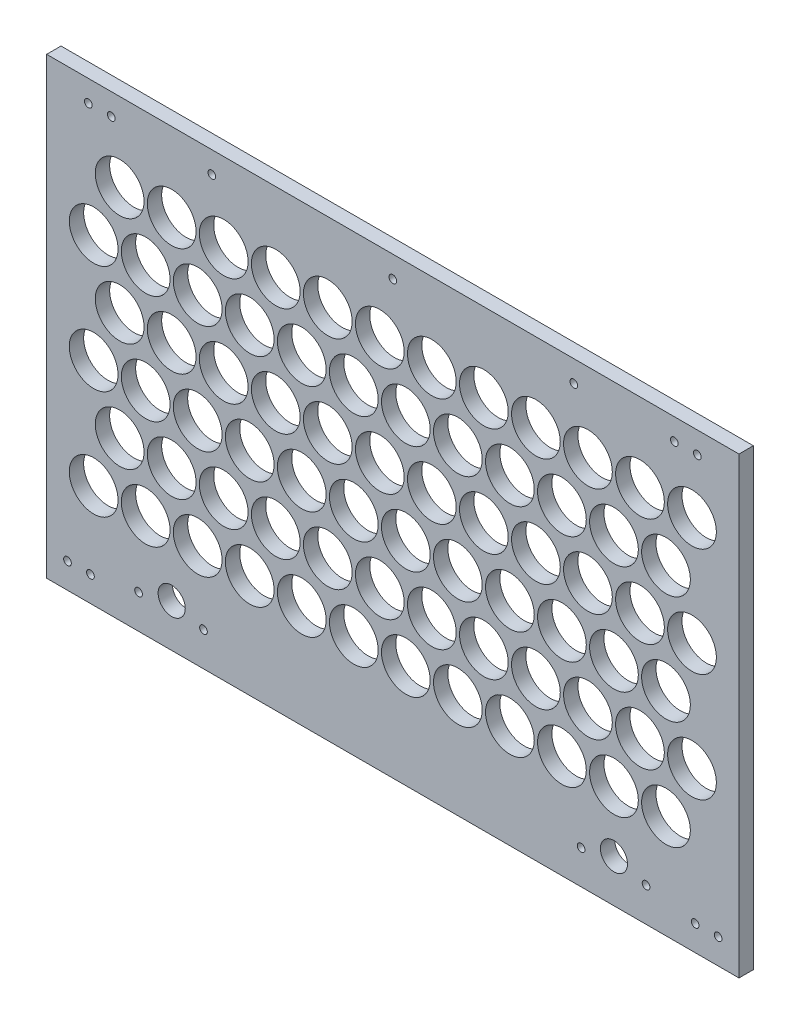
from build123d import *

# Parameters (mm, degrees)
SKETCH1_W                  = 306.05000007
SKETCH1_H                  = 197.4250001
BOSS_EXTRUDE1_DEPTH        = 6.35
CUT_EXTRUDE1_DEPTH         = 187.132543615
SKETCH4_R                  = 10.775
CUT_EXTRUDE2_DEPTH         = 187.132543615
LPATTERN1_COUNT            = 12
LPATTERN1_PITCH            = 23
LPATTERN2_COPY_1_DEPTH     = 187.132543615
LPATTERN2_COPY_2_DEPTH     = 187.132543615
LPATTERN2_COPY_3_DEPTH     = 187.132543615
LPATTERN2_COPY_4_DEPTH     = 187.132543615
LPATTERN2_COPY_5_DEPTH     = 187.132543615
LPATTERN2_COPY_6_DEPTH     = 187.132543615
LPATTERN2_COPY_7_DEPTH     = 187.132543615
LPATTERN2_COPY_8_DEPTH     = 187.132543615
LPATTERN2_COPY_9_DEPTH     = 187.132543615
LPATTERN2_COPY_10_DEPTH    = 187.132543615
LPATTERN2_COPY_11_DEPTH    = 187.132543615
LPATTERN2_COPY_12_DEPTH    = 187.132543615
LPATTERN2_COPY_13_DEPTH    = 187.132543615
LPATTERN2_COPY_14_DEPTH    = 187.132543615
LPATTERN2_COPY_15_DEPTH    = 187.132543615
LPATTERN2_COPY_16_DEPTH    = 187.132543615
LPATTERN2_COPY_17_DEPTH    = 187.132543615
LPATTERN2_COPY_18_DEPTH    = 187.132543615
LPATTERN2_COPY_19_DEPTH    = 187.132543615
LPATTERN2_COPY_20_DEPTH    = 187.132543615
LPATTERN2_COPY_21_DEPTH    = 187.132543615
LPATTERN2_COPY_22_DEPTH    = 187.132543615
LPATTERN2_COPY_23_SKETCH_R = 10.775
LPATTERN2_COPY_23_DEPTH    = 187.132543615
LPATTERN2_COPY_24_SKETCH_R = 10.775
LPATTERN2_COPY_24_DEPTH    = 187.132543615
LPATTERN2_COPY_25_SKETCH_R = 10.775
LPATTERN2_COPY_25_DEPTH    = 187.132543615
LPATTERN2_COPY_26_SKETCH_R = 10.775
LPATTERN2_COPY_26_DEPTH    = 187.132543615
LPATTERN2_COPY_27_SKETCH_R = 10.775
LPATTERN2_COPY_27_DEPTH    = 187.132543615
LPATTERN2_COPY_28_SKETCH_R = 10.775
LPATTERN2_COPY_28_DEPTH    = 187.132543615
LPATTERN2_COPY_29_SKETCH_R = 10.775
LPATTERN2_COPY_29_DEPTH    = 187.132543615
LPATTERN2_COPY_30_SKETCH_R = 10.775
LPATTERN2_COPY_30_DEPTH    = 187.132543615
LPATTERN2_COPY_31_SKETCH_R = 10.775
LPATTERN2_COPY_31_DEPTH    = 187.132543615
LPATTERN2_COPY_32_SKETCH_R = 10.775
LPATTERN2_COPY_32_DEPTH    = 187.132543615
LPATTERN2_COPY_33_SKETCH_R = 10.775
LPATTERN2_COPY_33_DEPTH    = 187.132543615
LPATTERN2_COPY_34_SKETCH_R = 10.775
LPATTERN2_COPY_34_DEPTH    = 187.132543615
LPATTERN2_COPY_35_SKETCH_R = 10.775
LPATTERN2_COPY_35_DEPTH    = 187.132543615
LPATTERN2_COPY_36_SKETCH_R = 10.775
LPATTERN2_COPY_36_DEPTH    = 187.132543615
LPATTERN2_COPY_37_SKETCH_R = 10.775
LPATTERN2_COPY_37_DEPTH    = 187.132543615
LPATTERN2_COPY_38_SKETCH_R = 10.775
LPATTERN2_COPY_38_DEPTH    = 187.132543615
LPATTERN2_COPY_39_SKETCH_R = 10.775
LPATTERN2_COPY_39_DEPTH    = 187.132543615
LPATTERN2_COPY_40_SKETCH_R = 10.775
LPATTERN2_COPY_40_DEPTH    = 187.132543615
LPATTERN2_COPY_41_SKETCH_R = 10.775
LPATTERN2_COPY_41_DEPTH    = 187.132543615
LPATTERN2_COPY_42_SKETCH_R = 10.775
LPATTERN2_COPY_42_DEPTH    = 187.132543615
LPATTERN2_COPY_43_SKETCH_R = 10.775
LPATTERN2_COPY_43_DEPTH    = 187.132543615
LPATTERN2_COPY_44_SKETCH_R = 10.775
LPATTERN2_COPY_44_DEPTH    = 187.132543615
LPATTERN2_COPY_45_DEPTH    = 187.132543615
LPATTERN2_COPY_46_DEPTH    = 187.132543615
LPATTERN2_COPY_47_SKETCH_R = 10.775
LPATTERN2_COPY_47_DEPTH    = 187.132543615
LPATTERN2_COPY_48_SKETCH_R = 10.775
LPATTERN2_COPY_48_DEPTH    = 187.132543615
SKETCH13_W                 = 306.05000007
SKETCH13_H                 = 6.35
BOSS_EXTRUDE2_DEPTH        = 3.175
SKETCH14_R                 = 6
CUT_EXTRUDE3_DEPTH         = 187.132543615
M3_CLEARANCE_HOLE1_D       = 3.4


with BuildPart() as part:
    # Sketch1 → Boss-Extrude1 (new body)
    with BuildSketch(Plane.XY):
        with Locations((3.5e-08, -7.06250005)):
            Rectangle(SKETCH1_W, SKETCH1_H)
    extrude(amount=BOSS_EXTRUDE1_DEPTH)

    # Sketch3 → Cut-Extrude1 (cut, through all)
    with BuildSketch(Plane.XY.offset(6.35)):
        with BuildLine():
            ThreePointArc((-121.475, -60), (-132.24999993, -49.225), (-143.025, -59.999999859))
            ThreePointArc((-143.025, -59.999999859), (-139.869075617, -67.619075517), (-132.25, -70.775))
            ThreePointArc((-132.25, -70.775), (-124.630924433, -67.619075567), (-121.475, -60))
        make_face()
    cut_extrude1 = extrude(amount=-CUT_EXTRUDE1_DEPTH, mode=Mode.SUBTRACT)

    # Sketch4 → Cut-Extrude2 (cut, through all)
    with BuildSketch(Plane.XY.offset(6.35)):
        with Locations((-120.75, -36)):
            Circle(SKETCH4_R)
    cut_extrude2 = extrude(amount=-CUT_EXTRUDE2_DEPTH, mode=Mode.SUBTRACT)

    # LPattern1: Cut-Extrude1, Cut-Extrude2 ×12
    with Locations(*[(i * LPATTERN1_PITCH, 0, 0) for i in range(1, LPATTERN1_COUNT)]):
        add(cut_extrude1, mode=Mode.SUBTRACT)
        add(cut_extrude2, mode=Mode.SUBTRACT)

    # LPattern2 copy 1 sketch → LPattern2 copy 1 (cut, through all)
    with BuildSketch(Plane(origin=(23, 48, 6.35), x_dir=(1, 0, 0), z_dir=(0, 0, 1))):
        with BuildLine():
            ThreePointArc((-121.475, -60), (-132.24999993, -49.225), (-143.025, -59.999999859))
            ThreePointArc((-143.025, -59.999999859), (-139.869075617, -67.619075517), (-132.25, -70.775))
            ThreePointArc((-132.25, -70.775), (-124.630924433, -67.619075567), (-121.475, -60))
        make_face()
    extrude(amount=-LPATTERN2_COPY_1_DEPTH, mode=Mode.SUBTRACT)

    # LPattern2 copy 2 sketch → LPattern2 copy 2 (cut, through all)
    with BuildSketch(Plane(origin=(23, 96, 6.35), x_dir=(1, 0, 0), z_dir=(0, 0, 1))):
        with BuildLine():
            ThreePointArc((-121.475, -60), (-132.24999993, -49.225), (-143.025, -59.999999859))
            ThreePointArc((-143.025, -59.999999859), (-139.869075617, -67.619075517), (-132.25, -70.775))
            ThreePointArc((-132.25, -70.775), (-124.630924433, -67.619075567), (-121.475, -60))
        make_face()
    extrude(amount=-LPATTERN2_COPY_2_DEPTH, mode=Mode.SUBTRACT)

    # LPattern2 copy 3 sketch → LPattern2 copy 3 (cut, through all)
    with BuildSketch(Plane(origin=(46, 48, 6.35), x_dir=(1, 0, 0), z_dir=(0, 0, 1))):
        with BuildLine():
            ThreePointArc((-121.475, -60), (-132.24999993, -49.225), (-143.025, -59.999999859))
            ThreePointArc((-143.025, -59.999999859), (-139.869075617, -67.619075517), (-132.25, -70.775))
            ThreePointArc((-132.25, -70.775), (-124.630924433, -67.619075567), (-121.475, -60))
        make_face()
    extrude(amount=-LPATTERN2_COPY_3_DEPTH, mode=Mode.SUBTRACT)

    # LPattern2 copy 4 sketch → LPattern2 copy 4 (cut, through all)
    with BuildSketch(Plane(origin=(46, 96, 6.35), x_dir=(1, 0, 0), z_dir=(0, 0, 1))):
        with BuildLine():
            ThreePointArc((-121.475, -60), (-132.24999993, -49.225), (-143.025, -59.999999859))
            ThreePointArc((-143.025, -59.999999859), (-139.869075617, -67.619075517), (-132.25, -70.775))
            ThreePointArc((-132.25, -70.775), (-124.630924433, -67.619075567), (-121.475, -60))
        make_face()
    extrude(amount=-LPATTERN2_COPY_4_DEPTH, mode=Mode.SUBTRACT)

    # LPattern2 copy 5 sketch → LPattern2 copy 5 (cut, through all)
    with BuildSketch(Plane(origin=(69, 48, 6.35), x_dir=(1, 0, 0), z_dir=(0, 0, 1))):
        with BuildLine():
            ThreePointArc((-121.475, -60), (-132.24999993, -49.225), (-143.025, -59.999999859))
            ThreePointArc((-143.025, -59.999999859), (-139.869075617, -67.619075517), (-132.25, -70.775))
            ThreePointArc((-132.25, -70.775), (-124.630924433, -67.619075567), (-121.475, -60))
        make_face()
    extrude(amount=-LPATTERN2_COPY_5_DEPTH, mode=Mode.SUBTRACT)

    # LPattern2 copy 6 sketch → LPattern2 copy 6 (cut, through all)
    with BuildSketch(Plane(origin=(69, 96, 6.35), x_dir=(1, 0, 0), z_dir=(0, 0, 1))):
        with BuildLine():
            ThreePointArc((-121.475, -60), (-132.24999993, -49.225), (-143.025, -59.999999859))
            ThreePointArc((-143.025, -59.999999859), (-139.869075617, -67.619075517), (-132.25, -70.775))
            ThreePointArc((-132.25, -70.775), (-124.630924433, -67.619075567), (-121.475, -60))
        make_face()
    extrude(amount=-LPATTERN2_COPY_6_DEPTH, mode=Mode.SUBTRACT)

    # LPattern2 copy 7 sketch → LPattern2 copy 7 (cut, through all)
    with BuildSketch(Plane(origin=(92, 48, 6.35), x_dir=(1, 0, 0), z_dir=(0, 0, 1))):
        with BuildLine():
            ThreePointArc((-121.475, -60), (-132.24999993, -49.225), (-143.025, -59.999999859))
            ThreePointArc((-143.025, -59.999999859), (-139.869075617, -67.619075517), (-132.25, -70.775))
            ThreePointArc((-132.25, -70.775), (-124.630924433, -67.619075567), (-121.475, -60))
        make_face()
    extrude(amount=-LPATTERN2_COPY_7_DEPTH, mode=Mode.SUBTRACT)

    # LPattern2 copy 8 sketch → LPattern2 copy 8 (cut, through all)
    with BuildSketch(Plane(origin=(92, 96, 6.35), x_dir=(1, 0, 0), z_dir=(0, 0, 1))):
        with BuildLine():
            ThreePointArc((-121.475, -60), (-132.24999993, -49.225), (-143.025, -59.999999859))
            ThreePointArc((-143.025, -59.999999859), (-139.869075617, -67.619075517), (-132.25, -70.775))
            ThreePointArc((-132.25, -70.775), (-124.630924433, -67.619075567), (-121.475, -60))
        make_face()
    extrude(amount=-LPATTERN2_COPY_8_DEPTH, mode=Mode.SUBTRACT)

    # LPattern2 copy 9 sketch → LPattern2 copy 9 (cut, through all)
    with BuildSketch(Plane(origin=(115, 48, 6.35), x_dir=(1, 0, 0), z_dir=(0, 0, 1))):
        with BuildLine():
            ThreePointArc((-121.475, -60), (-132.24999993, -49.225), (-143.025, -59.999999859))
            ThreePointArc((-143.025, -59.999999859), (-139.869075617, -67.619075517), (-132.25, -70.775))
            ThreePointArc((-132.25, -70.775), (-124.630924433, -67.619075567), (-121.475, -60))
        make_face()
    extrude(amount=-LPATTERN2_COPY_9_DEPTH, mode=Mode.SUBTRACT)

    # LPattern2 copy 10 sketch → LPattern2 copy 10 (cut, through all)
    with BuildSketch(Plane(origin=(115, 96, 6.35), x_dir=(1, 0, 0), z_dir=(0, 0, 1))):
        with BuildLine():
            ThreePointArc((-121.475, -60), (-132.24999993, -49.225), (-143.025, -59.999999859))
            ThreePointArc((-143.025, -59.999999859), (-139.869075617, -67.619075517), (-132.25, -70.775))
            ThreePointArc((-132.25, -70.775), (-124.630924433, -67.619075567), (-121.475, -60))
        make_face()
    extrude(amount=-LPATTERN2_COPY_10_DEPTH, mode=Mode.SUBTRACT)

    # LPattern2 copy 11 sketch → LPattern2 copy 11 (cut, through all)
    with BuildSketch(Plane(origin=(138, 48, 6.35), x_dir=(1, 0, 0), z_dir=(0, 0, 1))):
        with BuildLine():
            ThreePointArc((-121.475, -60), (-132.24999993, -49.225), (-143.025, -59.999999859))
            ThreePointArc((-143.025, -59.999999859), (-139.869075617, -67.619075517), (-132.25, -70.775))
            ThreePointArc((-132.25, -70.775), (-124.630924433, -67.619075567), (-121.475, -60))
        make_face()
    extrude(amount=-LPATTERN2_COPY_11_DEPTH, mode=Mode.SUBTRACT)

    # LPattern2 copy 12 sketch → LPattern2 copy 12 (cut, through all)
    with BuildSketch(Plane(origin=(138, 96, 6.35), x_dir=(1, 0, 0), z_dir=(0, 0, 1))):
        with BuildLine():
            ThreePointArc((-121.475, -60), (-132.24999993, -49.225), (-143.025, -59.999999859))
            ThreePointArc((-143.025, -59.999999859), (-139.869075617, -67.619075517), (-132.25, -70.775))
            ThreePointArc((-132.25, -70.775), (-124.630924433, -67.619075567), (-121.475, -60))
        make_face()
    extrude(amount=-LPATTERN2_COPY_12_DEPTH, mode=Mode.SUBTRACT)

    # LPattern2 copy 13 sketch → LPattern2 copy 13 (cut, through all)
    with BuildSketch(Plane(origin=(161, 48, 6.35), x_dir=(1, 0, 0), z_dir=(0, 0, 1))):
        with BuildLine():
            ThreePointArc((-121.475, -60), (-132.24999993, -49.225), (-143.025, -59.999999859))
            ThreePointArc((-143.025, -59.999999859), (-139.869075617, -67.619075517), (-132.25, -70.775))
            ThreePointArc((-132.25, -70.775), (-124.630924433, -67.619075567), (-121.475, -60))
        make_face()
    extrude(amount=-LPATTERN2_COPY_13_DEPTH, mode=Mode.SUBTRACT)

    # LPattern2 copy 14 sketch → LPattern2 copy 14 (cut, through all)
    with BuildSketch(Plane(origin=(161, 96, 6.35), x_dir=(1, 0, 0), z_dir=(0, 0, 1))):
        with BuildLine():
            ThreePointArc((-121.475, -60), (-132.24999993, -49.225), (-143.025, -59.999999859))
            ThreePointArc((-143.025, -59.999999859), (-139.869075617, -67.619075517), (-132.25, -70.775))
            ThreePointArc((-132.25, -70.775), (-124.630924433, -67.619075567), (-121.475, -60))
        make_face()
    extrude(amount=-LPATTERN2_COPY_14_DEPTH, mode=Mode.SUBTRACT)

    # LPattern2 copy 15 sketch → LPattern2 copy 15 (cut, through all)
    with BuildSketch(Plane(origin=(184, 48, 6.35), x_dir=(1, 0, 0), z_dir=(0, 0, 1))):
        with BuildLine():
            ThreePointArc((-121.475, -60), (-132.24999993, -49.225), (-143.025, -59.999999859))
            ThreePointArc((-143.025, -59.999999859), (-139.869075617, -67.619075517), (-132.25, -70.775))
            ThreePointArc((-132.25, -70.775), (-124.630924433, -67.619075567), (-121.475, -60))
        make_face()
    extrude(amount=-LPATTERN2_COPY_15_DEPTH, mode=Mode.SUBTRACT)

    # LPattern2 copy 16 sketch → LPattern2 copy 16 (cut, through all)
    with BuildSketch(Plane(origin=(184, 96, 6.35), x_dir=(1, 0, 0), z_dir=(0, 0, 1))):
        with BuildLine():
            ThreePointArc((-121.475, -60), (-132.24999993, -49.225), (-143.025, -59.999999859))
            ThreePointArc((-143.025, -59.999999859), (-139.869075617, -67.619075517), (-132.25, -70.775))
            ThreePointArc((-132.25, -70.775), (-124.630924433, -67.619075567), (-121.475, -60))
        make_face()
    extrude(amount=-LPATTERN2_COPY_16_DEPTH, mode=Mode.SUBTRACT)

    # LPattern2 copy 17 sketch → LPattern2 copy 17 (cut, through all)
    with BuildSketch(Plane(origin=(207, 48, 6.35), x_dir=(1, 0, 0), z_dir=(0, 0, 1))):
        with BuildLine():
            ThreePointArc((-121.475, -60), (-132.24999993, -49.225), (-143.025, -59.999999859))
            ThreePointArc((-143.025, -59.999999859), (-139.869075617, -67.619075517), (-132.25, -70.775))
            ThreePointArc((-132.25, -70.775), (-124.630924433, -67.619075567), (-121.475, -60))
        make_face()
    extrude(amount=-LPATTERN2_COPY_17_DEPTH, mode=Mode.SUBTRACT)

    # LPattern2 copy 18 sketch → LPattern2 copy 18 (cut, through all)
    with BuildSketch(Plane(origin=(207, 96, 6.35), x_dir=(1, 0, 0), z_dir=(0, 0, 1))):
        with BuildLine():
            ThreePointArc((-121.475, -60), (-132.24999993, -49.225), (-143.025, -59.999999859))
            ThreePointArc((-143.025, -59.999999859), (-139.869075617, -67.619075517), (-132.25, -70.775))
            ThreePointArc((-132.25, -70.775), (-124.630924433, -67.619075567), (-121.475, -60))
        make_face()
    extrude(amount=-LPATTERN2_COPY_18_DEPTH, mode=Mode.SUBTRACT)

    # LPattern2 copy 19 sketch → LPattern2 copy 19 (cut, through all)
    with BuildSketch(Plane(origin=(230, 48, 6.35), x_dir=(1, 0, 0), z_dir=(0, 0, 1))):
        with BuildLine():
            ThreePointArc((-121.475, -60), (-132.24999993, -49.225), (-143.025, -59.999999859))
            ThreePointArc((-143.025, -59.999999859), (-139.869075617, -67.619075517), (-132.25, -70.775))
            ThreePointArc((-132.25, -70.775), (-124.630924433, -67.619075567), (-121.475, -60))
        make_face()
    extrude(amount=-LPATTERN2_COPY_19_DEPTH, mode=Mode.SUBTRACT)

    # LPattern2 copy 20 sketch → LPattern2 copy 20 (cut, through all)
    with BuildSketch(Plane(origin=(230, 96, 6.35), x_dir=(1, 0, 0), z_dir=(0, 0, 1))):
        with BuildLine():
            ThreePointArc((-121.475, -60), (-132.24999993, -49.225), (-143.025, -59.999999859))
            ThreePointArc((-143.025, -59.999999859), (-139.869075617, -67.619075517), (-132.25, -70.775))
            ThreePointArc((-132.25, -70.775), (-124.630924433, -67.619075567), (-121.475, -60))
        make_face()
    extrude(amount=-LPATTERN2_COPY_20_DEPTH, mode=Mode.SUBTRACT)

    # LPattern2 copy 21 sketch → LPattern2 copy 21 (cut, through all)
    with BuildSketch(Plane(origin=(253, 48, 6.35), x_dir=(1, 0, 0), z_dir=(0, 0, 1))):
        with BuildLine():
            ThreePointArc((-121.475, -60), (-132.24999993, -49.225), (-143.025, -59.999999859))
            ThreePointArc((-143.025, -59.999999859), (-139.869075617, -67.619075517), (-132.25, -70.775))
            ThreePointArc((-132.25, -70.775), (-124.630924433, -67.619075567), (-121.475, -60))
        make_face()
    extrude(amount=-LPATTERN2_COPY_21_DEPTH, mode=Mode.SUBTRACT)

    # LPattern2 copy 22 sketch → LPattern2 copy 22 (cut, through all)
    with BuildSketch(Plane(origin=(253, 96, 6.35), x_dir=(1, 0, 0), z_dir=(0, 0, 1))):
        with BuildLine():
            ThreePointArc((-121.475, -60), (-132.24999993, -49.225), (-143.025, -59.999999859))
            ThreePointArc((-143.025, -59.999999859), (-139.869075617, -67.619075517), (-132.25, -70.775))
            ThreePointArc((-132.25, -70.775), (-124.630924433, -67.619075567), (-121.475, -60))
        make_face()
    extrude(amount=-LPATTERN2_COPY_22_DEPTH, mode=Mode.SUBTRACT)

    # LPattern2 copy 23 sketch → LPattern2 copy 23 (cut, through all)
    with BuildSketch(Plane(origin=(23, 48, 6.35), x_dir=(1, 0, 0), z_dir=(0, 0, 1))):
        with Locations((-120.75, -36)):
            Circle(LPATTERN2_COPY_23_SKETCH_R)
    extrude(amount=-LPATTERN2_COPY_23_DEPTH, mode=Mode.SUBTRACT)

    # LPattern2 copy 24 sketch → LPattern2 copy 24 (cut, through all)
    with BuildSketch(Plane(origin=(23, 96, 6.35), x_dir=(1, 0, 0), z_dir=(0, 0, 1))):
        with Locations((-120.75, -36)):
            Circle(LPATTERN2_COPY_24_SKETCH_R)
    extrude(amount=-LPATTERN2_COPY_24_DEPTH, mode=Mode.SUBTRACT)

    # LPattern2 copy 25 sketch → LPattern2 copy 25 (cut, through all)
    with BuildSketch(Plane(origin=(46, 48, 6.35), x_dir=(1, 0, 0), z_dir=(0, 0, 1))):
        with Locations((-120.75, -36)):
            Circle(LPATTERN2_COPY_25_SKETCH_R)
    extrude(amount=-LPATTERN2_COPY_25_DEPTH, mode=Mode.SUBTRACT)

    # LPattern2 copy 26 sketch → LPattern2 copy 26 (cut, through all)
    with BuildSketch(Plane(origin=(46, 96, 6.35), x_dir=(1, 0, 0), z_dir=(0, 0, 1))):
        with Locations((-120.75, -36)):
            Circle(LPATTERN2_COPY_26_SKETCH_R)
    extrude(amount=-LPATTERN2_COPY_26_DEPTH, mode=Mode.SUBTRACT)

    # LPattern2 copy 27 sketch → LPattern2 copy 27 (cut, through all)
    with BuildSketch(Plane(origin=(69, 48, 6.35), x_dir=(1, 0, 0), z_dir=(0, 0, 1))):
        with Locations((-120.75, -36)):
            Circle(LPATTERN2_COPY_27_SKETCH_R)
    extrude(amount=-LPATTERN2_COPY_27_DEPTH, mode=Mode.SUBTRACT)

    # LPattern2 copy 28 sketch → LPattern2 copy 28 (cut, through all)
    with BuildSketch(Plane(origin=(69, 96, 6.35), x_dir=(1, 0, 0), z_dir=(0, 0, 1))):
        with Locations((-120.75, -36)):
            Circle(LPATTERN2_COPY_28_SKETCH_R)
    extrude(amount=-LPATTERN2_COPY_28_DEPTH, mode=Mode.SUBTRACT)

    # LPattern2 copy 29 sketch → LPattern2 copy 29 (cut, through all)
    with BuildSketch(Plane(origin=(92, 48, 6.35), x_dir=(1, 0, 0), z_dir=(0, 0, 1))):
        with Locations((-120.75, -36)):
            Circle(LPATTERN2_COPY_29_SKETCH_R)
    extrude(amount=-LPATTERN2_COPY_29_DEPTH, mode=Mode.SUBTRACT)

    # LPattern2 copy 30 sketch → LPattern2 copy 30 (cut, through all)
    with BuildSketch(Plane(origin=(92, 96, 6.35), x_dir=(1, 0, 0), z_dir=(0, 0, 1))):
        with Locations((-120.75, -36)):
            Circle(LPATTERN2_COPY_30_SKETCH_R)
    extrude(amount=-LPATTERN2_COPY_30_DEPTH, mode=Mode.SUBTRACT)

    # LPattern2 copy 31 sketch → LPattern2 copy 31 (cut, through all)
    with BuildSketch(Plane(origin=(115, 48, 6.35), x_dir=(1, 0, 0), z_dir=(0, 0, 1))):
        with Locations((-120.75, -36)):
            Circle(LPATTERN2_COPY_31_SKETCH_R)
    extrude(amount=-LPATTERN2_COPY_31_DEPTH, mode=Mode.SUBTRACT)

    # LPattern2 copy 32 sketch → LPattern2 copy 32 (cut, through all)
    with BuildSketch(Plane(origin=(115, 96, 6.35), x_dir=(1, 0, 0), z_dir=(0, 0, 1))):
        with Locations((-120.75, -36)):
            Circle(LPATTERN2_COPY_32_SKETCH_R)
    extrude(amount=-LPATTERN2_COPY_32_DEPTH, mode=Mode.SUBTRACT)

    # LPattern2 copy 33 sketch → LPattern2 copy 33 (cut, through all)
    with BuildSketch(Plane(origin=(138, 48, 6.35), x_dir=(1, 0, 0), z_dir=(0, 0, 1))):
        with Locations((-120.75, -36)):
            Circle(LPATTERN2_COPY_33_SKETCH_R)
    extrude(amount=-LPATTERN2_COPY_33_DEPTH, mode=Mode.SUBTRACT)

    # LPattern2 copy 34 sketch → LPattern2 copy 34 (cut, through all)
    with BuildSketch(Plane(origin=(138, 96, 6.35), x_dir=(1, 0, 0), z_dir=(0, 0, 1))):
        with Locations((-120.75, -36)):
            Circle(LPATTERN2_COPY_34_SKETCH_R)
    extrude(amount=-LPATTERN2_COPY_34_DEPTH, mode=Mode.SUBTRACT)

    # LPattern2 copy 35 sketch → LPattern2 copy 35 (cut, through all)
    with BuildSketch(Plane(origin=(161, 48, 6.35), x_dir=(1, 0, 0), z_dir=(0, 0, 1))):
        with Locations((-120.75, -36)):
            Circle(LPATTERN2_COPY_35_SKETCH_R)
    extrude(amount=-LPATTERN2_COPY_35_DEPTH, mode=Mode.SUBTRACT)

    # LPattern2 copy 36 sketch → LPattern2 copy 36 (cut, through all)
    with BuildSketch(Plane(origin=(161, 96, 6.35), x_dir=(1, 0, 0), z_dir=(0, 0, 1))):
        with Locations((-120.75, -36)):
            Circle(LPATTERN2_COPY_36_SKETCH_R)
    extrude(amount=-LPATTERN2_COPY_36_DEPTH, mode=Mode.SUBTRACT)

    # LPattern2 copy 37 sketch → LPattern2 copy 37 (cut, through all)
    with BuildSketch(Plane(origin=(184, 48, 6.35), x_dir=(1, 0, 0), z_dir=(0, 0, 1))):
        with Locations((-120.75, -36)):
            Circle(LPATTERN2_COPY_37_SKETCH_R)
    extrude(amount=-LPATTERN2_COPY_37_DEPTH, mode=Mode.SUBTRACT)

    # LPattern2 copy 38 sketch → LPattern2 copy 38 (cut, through all)
    with BuildSketch(Plane(origin=(184, 96, 6.35), x_dir=(1, 0, 0), z_dir=(0, 0, 1))):
        with Locations((-120.75, -36)):
            Circle(LPATTERN2_COPY_38_SKETCH_R)
    extrude(amount=-LPATTERN2_COPY_38_DEPTH, mode=Mode.SUBTRACT)

    # LPattern2 copy 39 sketch → LPattern2 copy 39 (cut, through all)
    with BuildSketch(Plane(origin=(207, 48, 6.35), x_dir=(1, 0, 0), z_dir=(0, 0, 1))):
        with Locations((-120.75, -36)):
            Circle(LPATTERN2_COPY_39_SKETCH_R)
    extrude(amount=-LPATTERN2_COPY_39_DEPTH, mode=Mode.SUBTRACT)

    # LPattern2 copy 40 sketch → LPattern2 copy 40 (cut, through all)
    with BuildSketch(Plane(origin=(207, 96, 6.35), x_dir=(1, 0, 0), z_dir=(0, 0, 1))):
        with Locations((-120.75, -36)):
            Circle(LPATTERN2_COPY_40_SKETCH_R)
    extrude(amount=-LPATTERN2_COPY_40_DEPTH, mode=Mode.SUBTRACT)

    # LPattern2 copy 41 sketch → LPattern2 copy 41 (cut, through all)
    with BuildSketch(Plane(origin=(230, 48, 6.35), x_dir=(1, 0, 0), z_dir=(0, 0, 1))):
        with Locations((-120.75, -36)):
            Circle(LPATTERN2_COPY_41_SKETCH_R)
    extrude(amount=-LPATTERN2_COPY_41_DEPTH, mode=Mode.SUBTRACT)

    # LPattern2 copy 42 sketch → LPattern2 copy 42 (cut, through all)
    with BuildSketch(Plane(origin=(230, 96, 6.35), x_dir=(1, 0, 0), z_dir=(0, 0, 1))):
        with Locations((-120.75, -36)):
            Circle(LPATTERN2_COPY_42_SKETCH_R)
    extrude(amount=-LPATTERN2_COPY_42_DEPTH, mode=Mode.SUBTRACT)

    # LPattern2 copy 43 sketch → LPattern2 copy 43 (cut, through all)
    with BuildSketch(Plane(origin=(253, 48, 6.35), x_dir=(1, 0, 0), z_dir=(0, 0, 1))):
        with Locations((-120.75, -36)):
            Circle(LPATTERN2_COPY_43_SKETCH_R)
    extrude(amount=-LPATTERN2_COPY_43_DEPTH, mode=Mode.SUBTRACT)

    # LPattern2 copy 44 sketch → LPattern2 copy 44 (cut, through all)
    with BuildSketch(Plane(origin=(253, 96, 6.35), x_dir=(1, 0, 0), z_dir=(0, 0, 1))):
        with Locations((-120.75, -36)):
            Circle(LPATTERN2_COPY_44_SKETCH_R)
    extrude(amount=-LPATTERN2_COPY_44_DEPTH, mode=Mode.SUBTRACT)

    # LPattern2 copy 45 sketch → LPattern2 copy 45 (cut, through all)
    with BuildSketch(Plane(origin=(0, 48, 6.35), x_dir=(1, 0, 0), z_dir=(0, 0, 1))):
        with BuildLine():
            ThreePointArc((-121.475, -60), (-132.24999993, -49.225), (-143.025, -59.999999859))
            ThreePointArc((-143.025, -59.999999859), (-139.869075617, -67.619075517), (-132.25, -70.775))
            ThreePointArc((-132.25, -70.775), (-124.630924433, -67.619075567), (-121.475, -60))
        make_face()
    extrude(amount=-LPATTERN2_COPY_45_DEPTH, mode=Mode.SUBTRACT)

    # LPattern2 copy 46 sketch → LPattern2 copy 46 (cut, through all)
    with BuildSketch(Plane(origin=(0, 96, 6.35), x_dir=(1, 0, 0), z_dir=(0, 0, 1))):
        with BuildLine():
            ThreePointArc((-121.475, -60), (-132.24999993, -49.225), (-143.025, -59.999999859))
            ThreePointArc((-143.025, -59.999999859), (-139.869075617, -67.619075517), (-132.25, -70.775))
            ThreePointArc((-132.25, -70.775), (-124.630924433, -67.619075567), (-121.475, -60))
        make_face()
    extrude(amount=-LPATTERN2_COPY_46_DEPTH, mode=Mode.SUBTRACT)

    # LPattern2 copy 47 sketch → LPattern2 copy 47 (cut, through all)
    with BuildSketch(Plane(origin=(0, 48, 6.35), x_dir=(1, 0, 0), z_dir=(0, 0, 1))):
        with Locations((-120.75, -36)):
            Circle(LPATTERN2_COPY_47_SKETCH_R)
    extrude(amount=-LPATTERN2_COPY_47_DEPTH, mode=Mode.SUBTRACT)

    # LPattern2 copy 48 sketch → LPattern2 copy 48 (cut, through all)
    with BuildSketch(Plane(origin=(0, 96, 6.35), x_dir=(1, 0, 0), z_dir=(0, 0, 1))):
        with Locations((-120.75, -36)):
            Circle(LPATTERN2_COPY_48_SKETCH_R)
    extrude(amount=-LPATTERN2_COPY_48_DEPTH, mode=Mode.SUBTRACT)

    # Sketch13 → Boss-Extrude2 (add)
    with BuildSketch(Plane(origin=(0, 91.65, 0), x_dir=(1, 0, 0), z_dir=(0, 1, 0))):
        with Locations((3.5e-08, -3.175)):
            Rectangle(SKETCH13_W, SKETCH13_H)
    extrude(amount=BOSS_EXTRUDE2_DEPTH)

    # Sketch14 → Cut-Extrude3 (cut, through all)
    with BuildSketch(Plane(origin=(0, 0, 0), x_dir=(-1, 0, 0), z_dir=(0, 0, -1))):
        with Locations((-97.75, -86.7750001)):
            Circle(SKETCH14_R)
    cut_extrude3 = extrude(amount=-CUT_EXTRUDE3_DEPTH, mode=Mode.SUBTRACT)

    # Mirror1: Cut-Extrude3 across plane
    add(cut_extrude3.mirror(Plane(origin=(0, 0, 0), x_dir=(0, 0, 1), z_dir=(1, 0, 0))), mode=Mode.SUBTRACT)

    # M3 Clearance Hole1 (through all)
    with Locations(Plane(origin=(0, 0, 0), x_dir=(-1, 0, 0), z_dir=(0, 0, -1))):
        with Locations((-111.94, -90.775), (-83.25, -90.775), (83.712, -90.775), (80, 85.3), (0, 85.3), (-80, 85.3), (112.402, -90.775), (-143.817500066, -94.6000001), (-133.657500066, -94.6000001), (-134.610000066, 85.3), (-124.450000066, 85.3), (124.450000066, 85.3), (134.610000066, 85.3), (133.657500066, -94.6000001), (143.817500066, -94.6000001)):
            Hole(M3_CLEARANCE_HOLE1_D / 2)


solid = part.part
